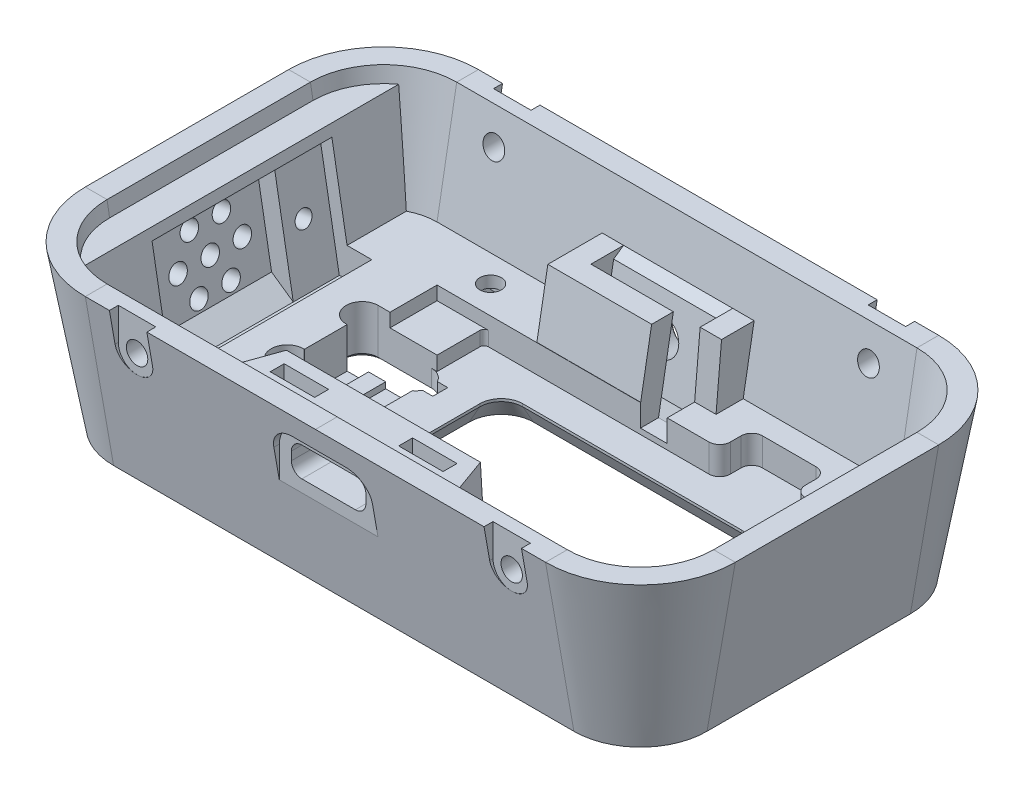
from build123d import *
from OCP.BRepFilletAPI import BRepFilletAPI_MakeChamfer

# Parameters (mm, degrees)
SKETCH57_W                      = 67.31
SKETCH57_H                      = 36.83
BOSS_EXTRUDE18_DEPTH            = 2.54
CUT_EXTRUDE28_DEPTH             = 39.447663778
FILLET5_R                       = 6.35
BOSS_EXTRUDE2_START             = 3.302
SKETCH4_W                       = 51.816
SKETCH4_H                       = 23.876
BOSS_EXTRUDE2_DEPTH             = 3.302
SKETCH5_W                       = 4.953
SKETCH5_H                       = 5.588
SKETCH5_W_2                     = 5.588
SKETCH5_W_3                     = 5.334
SKETCH5_H_2                     = 6.35
BOSS_EXTRUDE3_DEPTH             = 1.6891
SKETCH7_R                       = 1.5875
CUT_EXTRUDE3_DEPTH              = 1.9812
SKETCH8_R                       = 0.635
CUT_EXTRUDE4_DEPTH              = 49.097728858
CUT_EXTRUDE5_DEPTH              = 48.996469213
CUT_EXTRUDE5_DEPTH_BACK         = 48.996469213
CUT_EXTRUDE6_DEPTH              = 48.441964902
CUT_EXTRUDE6_DEPTH_BACK         = 3.175
SKETCH10_W                      = 2.54
SKETCH10_H                      = 7.29723455
SKETCH11_W                      = 5.973982403
SKETCH11_H                      = 1.778
CUT_EXTRUDE7_DEPTH              = 1.4859
SKETCH59_W                      = 3.683
SKETCH59_H                      = 5.08
CUT_EXTRUDE29_DEPTH             = 0.2921
CHAMFER3_SIZE                   = 0.508
CHAMFER6_SIZE                   = 2.2225
CHAMFER6_SIZE2                  = 1.283160973
SKETCH76_R                      = 1.27
CUT_EXTRUDE39_DEPTH             = 4.826
CUT_EXTRUDE35_DEPTH             = 1.7018
SKETCH73_W                      = 2.54
SKETCH73_H                      = 5.2705
CUT_EXTRUDE37_DEPTH             = 0.5
SKETCH75_W                      = 2.54
SKETCH75_H                      = 2.54
CUT_EXTRUDE38_DEPTH             = 0.5
MIRROR4_COPY_1_DEPTH            = 1.7018
MIRROR4_COPY_2_SKETCH_W         = 2.54
MIRROR4_COPY_2_SKETCH_H         = 5.2705
MIRROR4_COPY_2_DEPTH            = 0.5
MIRROR4_COPY_3_SKETCH_W         = 2.54
MIRROR4_COPY_3_SKETCH_H         = 2.54
MIRROR4_COPY_3_DEPTH            = 0.5
SKETCH79_W                      = 2.794
SKETCH79_H                      = 5.842
CUT_EXTRUDE41_DEPTH             = 1.016
CUT_EXTRUDE18_REACH             = 57.618
SKETCH28_W                      = 12.954
SKETCH28_H                      = 10.476570005
SKETCH18_R                      = 2.00025
CUT_EXTRUDE14_DEPTH             = 60.890421674
SKETCH19_W                      = 18.034
SKETCH19_H                      = 15.748
SKETCH19_W_2                    = 12.954
SKETCH19_H_2                    = 10.668
BOSS_EXTRUDE4_DEPTH             = 3.81
SKETCH23_W                      = 12.954
SKETCH23_H                      = 3.81
CUT_EXTRUDE15_DEPTH             = 50.268858544
CUT_EXTRUDE34_REACH             = 56.18
CUT_EXTRUDE34_DIRECTION_2_REACH = 56.18
BOSS_EXTRUDE6_DEPTH             = 18.034
CUT_EXTRUDE17_REACH             = 57.618
SKETCH27_W                      = 3.175
SKETCH27_H                      = 20.919786291
CUT_EXTRUDE30_REACH             = 58.309
CUT_EXTRUDE40_DEPTH             = 5.715
CHAMFER8_SIZE                   = 0.254
BOSS_EXTRUDE19_START            = 1.016
SKETCH78_W                      = 12.954
SKETCH78_H                      = 10.832571096
SKETCH78_R                      = 2.00025
BOSS_EXTRUDE19_DEPTH            = 1.016
CHAMFER9_SIZE                   = 1.016
CUT_EXTRUDE20_DEPTH             = 3.140582
SKETCH36_R                      = 1.27
CUT_EXTRUDE21_DEPTH             = 5.715
BOSS_EXTRUDE9_DEPTH             = 11.43
CUT_EXTRUDE22_DEPTH             = 58.778283606
CUT_EXTRUDE23_DEPTH             = 20.32
SKETCH42_R                      = 1.27
CUT_EXTRUDE24_DEPTH             = 5.08
SKETCH64_W                      = 8.8392
SKETCH64_H                      = 6.9977
CUT_EXTRUDE31_DEPTH             = 1.27
CUT_EXTRUDE33_DEPTH             = 1.651
CUT_EXTRUDE32_REACH             = 60.362
CHAMFER7_SIZE                   = 5.334
CHAMFER7_SIZE_2                 = 1.94141723
CUT_EXTRUDE25_DEPTH             = 10.668
SKETCH48_W                      = 24.384
SKETCH48_H                      = 16.51
SKETCH48_W_2                    = 21.336
SKETCH48_H_2                    = 13.716
BOSS_EXTRUDE12_DEPTH            = 3.7465
SKETCH45_R                      = 0.9906
BOSS_EXTRUDE10_DEPTH            = 2.2225
BOSS_EXTRUDE14_DEPTH            = 2.2225
CHAMFER5_SIZE                   = 2.2225
BOSS_EXTRUDE15_REACH            = 57.779
CUT_EXTRUDE27_START             = -3.81
SKETCH54_R                      = 0.9906
CUT_EXTRUDE27_DEPTH             = 3.81
FILL_START                      = -34.669252274
FILL_PATTERN2_OUTLINE_R         = 1.0795
FILL_PATTERN2_DEPTH             = 2.159
BOSS_EXTRUDE16_REACH            = 57.779
BOSS_EXTRUDE17_REACH            = 57.779
SKETCH80_W                      = 8.89
SKETCH80_H                      = 3.81
CUT_EXTRUDE42_DEPTH             = 3.302
FILLET8_R                       = 1.27
FILLET6_R                       = 0.508


with BuildPart() as part:
    # Sketch57 → Boss-Extrude18 (new body)
    with BuildSketch(Plane(origin=(0, 0, 0), x_dir=(1, 0, 0), z_dir=(0, 1, 0))):
        Rectangle(SKETCH57_W, SKETCH57_H)
    extrude(amount=BOSS_EXTRUDE18_DEPTH)

    # Sketch58 → Cut-Extrude28 (cut, through all)
    with BuildSketch(Plane(origin=(0, 2.54, 0), x_dir=(1, 0, 0), z_dir=(0, 1, 0))):
        with BuildLine():
            Line((-9.398, 5.588), (-9.398, -5.6134))
            ThreePointArc((-9.398, -5.6134), (-8.654051224, -7.409451224), (-6.858, -8.1534))
            Line((-6.858, -8.1534), (19.0754, -8.1534))
            ThreePointArc((19.0754, -8.1534), (20.871451224, -7.409451224), (21.6154, -5.6134))
            Line((21.6154, -5.6134), (21.6154, 5.588))
            ThreePointArc((21.6154, 5.588), (20.871451224, 7.384051224), (19.0754, 8.128))
            Line((19.0754, 8.128), (-6.858, 8.128))
            ThreePointArc((-6.858, 8.128), (-8.654051224, 7.384051224), (-9.398, 5.588))
        make_face()
    extrude(amount=-CUT_EXTRUDE28_DEPTH, mode=Mode.SUBTRACT)

    # Fillet5
    fillet5_edges = [part.edges().sort_by_distance(p)[0] for p in [
        (33.655, 1.27, 18.415),
        (-33.655, 1.27, 18.415),
        (-33.655, 1.27, -18.415),
        (33.655, 1.27, -18.415),
    ]]
    fillet(fillet5_edges, radius=FILLET5_R)

    # Sketch4 → Boss-Extrude2 (add)
    with BuildSketch(Plane(origin=(0, 2.54, 0), x_dir=(1, 0, 0), z_dir=(0, 1, 0)).offset(BOSS_EXTRUDE2_START)):
        with BuildLine():
            Line((27.305, 18.415), (-27.305, 18.415))
            ThreePointArc((-27.305, 18.415), (-31.795128061, 16.555128061), (-33.655, 12.065))
            Line((-33.655, 12.065), (-33.655, -12.065))
            ThreePointArc((-33.655, -12.065), (-31.795128061, -16.555128061), (-27.305, -18.415))
            Line((-27.305, -18.415), (27.305, -18.415))
            ThreePointArc((27.305, -18.415), (31.795128061, -16.555128061), (33.655, -12.065))
            Line((33.655, -12.065), (33.655, 12.065))
            ThreePointArc((33.655, 12.065), (31.795128061, 16.555128061), (27.305, 18.415))
        make_face()
        with Locations((5.08, 0)):
            Rectangle(SKETCH4_W, SKETCH4_H, mode=Mode.SUBTRACT)
    extrude(amount=-BOSS_EXTRUDE2_DEPTH)

    # Sweep1: sweep along a path in Sketch15
    with BuildLine(Plane.XZ) as sweep1_path:
        Line((-33.655, 12.065), (-33.655, -12.065))
        ThreePointArc((-33.655, -12.065), (-31.795128061, -16.555128061), (-27.305, -18.415))
        Line((-27.305, -18.415), (27.305, -18.415))
        ThreePointArc((27.305, -18.415), (31.795128061, -16.555128061), (33.655, -12.065))
        Line((33.655, -12.065), (33.655, 12.065))
        ThreePointArc((33.655, 12.065), (31.795128061, 16.555128061), (27.305, 18.415))
        Line((27.305, 18.415), (-27.305, 18.415))
        ThreePointArc((-27.305, 18.415), (-31.795128061, 16.555128061), (-33.655, 12.065))
    # Sketch14 → Sweep1 (sweep)
    with BuildSketch(Plane(origin=(0, 0, 0), x_dir=(0, 0, -1), z_dir=(1, 0, 0))):
        Polygon((-19.964081373, 0), (-23.323110355, 19.05), (-20.743926761, 19.05), (-17.384897779, 0), align=None)
    sweep(path=sweep1_path.line)

    # Sketch5 → Boss-Extrude3 (add)
    with BuildSketch(Plane(origin=(0, 2.54, 0), x_dir=(1, 0, 0), z_dir=(0, 1, 0))):
        with Locations((-18.3515, -9.144)):
            Rectangle(SKETCH5_W, SKETCH5_H)
        with Locations((-18.034, 9.144)):
            Rectangle(SKETCH5_W_2, SKETCH5_H)
        with Locations((28.321, -8.763)):
            Rectangle(SKETCH5_W_3, SKETCH5_H_2)
        with Locations((28.321, 8.763)):
            Rectangle(SKETCH5_W_3, SKETCH5_H_2)
    extrude(amount=BOSS_EXTRUDE3_DEPTH)

    # Sketch7 → Cut-Extrude3 (cut)
    with BuildSketch(Plane(origin=(0, 4.2291, 0), x_dir=(1, 0, 0), z_dir=(0, 1, 0))):
        with Locations(Location((-12.954, -9.398, 0), (0, 0, 270))):
            Circle(SKETCH7_R)
    extrude(amount=-CUT_EXTRUDE3_DEPTH, mode=Mode.SUBTRACT)

    # Sketch8 → Cut-Extrude4 (cut, through all)
    with BuildSketch(Plane(origin=(0, 2.2479, 0), x_dir=(1, 0, 0), z_dir=(0, 1, 0))):
        with Locations(Location((-12.954, -9.398, 0), (0, 0, 270))):
            Circle(SKETCH8_R)
    extrude(amount=-CUT_EXTRUDE4_DEPTH, mode=Mode.SUBTRACT)

    # Sketch9 → Cut-Extrude5 (cut, two sides: drawn at the far end of the back side and taken through both)
    with BuildSketch(Plane.XZ.offset(-2.54).offset(-CUT_EXTRUDE5_DEPTH_BACK)):
        with BuildLine():
            Line((-15.875, -6.35), (-22.225, -6.35))
            ThreePointArc((-22.225, -6.35), (-24.13, -4.445), (-22.225, -2.54))
            Line((-22.225, -2.54), (-15.875, -2.54))
            ThreePointArc((-15.875, -2.54), (-13.97, -4.445), (-15.875, -6.35))
        make_face()
        with BuildLine():
            Line((-15.875, 6.35), (-22.225, 6.35))
            ThreePointArc((-22.225, 6.35), (-24.13, 4.445), (-22.225, 2.54))
            Line((-22.225, 2.54), (-15.875, 2.54))
            ThreePointArc((-15.875, 2.54), (-13.97, 4.445), (-15.875, 6.35))
        make_face()
    extrude(amount=CUT_EXTRUDE5_DEPTH + CUT_EXTRUDE5_DEPTH_BACK, mode=Mode.SUBTRACT)

    # Sketch10 → Cut-Extrude6 (cut, two sides: drawn at the far end of the back side and taken through both)
    with BuildSketch(Plane(origin=(0, 4.2291, 0), x_dir=(1, 0, 0), z_dir=(0, 1, 0)).offset(-CUT_EXTRUDE6_DEPTH_BACK)):
        with Locations((-20.828, -0.008670508)):
            Rectangle(SKETCH10_W, SKETCH10_H)
    extrude(amount=CUT_EXTRUDE6_DEPTH + CUT_EXTRUDE6_DEPTH_BACK, mode=Mode.SUBTRACT)

    # Sketch11 → Cut-Extrude7 (cut)
    with BuildSketch(Plane(origin=(0, 2.54, 0), x_dir=(1, 0, 0), z_dir=(0, 1, 0))):
        with Locations((-15.940991202, 4.445)):
            Rectangle(SKETCH11_W, SKETCH11_H)
        with Locations((-15.940991202, -4.445)):
            Rectangle(SKETCH11_W, SKETCH11_H)
    extrude(amount=-CUT_EXTRUDE7_DEPTH, mode=Mode.SUBTRACT)

    # Sketch59 → Cut-Extrude29 (cut)
    with BuildSketch(Plane(origin=(0, 2.54, 0), x_dir=(1, 0, 0), z_dir=(0, 1, 0))):
        with Locations((-17.7165, 0)):
            Rectangle(SKETCH59_W, SKETCH59_H)
    extrude(amount=-CUT_EXTRUDE29_DEPTH, mode=Mode.SUBTRACT)

    # Chamfer3
    chamfer3_edges = [part.edges().sort_by_distance(p)[0] for p in [
        (-13.97, 0, -4.445),
        (-19.05, 0, -2.54),
        (-24.13, 0, -4.445),
        (-19.05, 0, -6.35),
        (-13.97, 0, 4.445),
        (-19.05, 0, 6.35),
        (-24.13, 0, 4.445),
        (-19.05, 0, 2.54),
    ]]
    chamfer(chamfer3_edges, length=CHAMFER3_SIZE)

    # Chamfer6: one chamfer whose edges measure the first distance from different faces: ONE call of the kernel's chamfer builder (chamfer() names one face for all edges)
    chamfer6_edges_1 = [part.edges().sort_by_distance(p)[0] for p in [
        (-8.654051224, 0, 7.409451224),
    ]]
    chamfer6_side_1 = [part.faces().sort_by_distance(p)[0] for p in [
        (-8.654051224, 1.27, 7.409451224),
    ]]
    chamfer6_edges_2 = [part.edges().sort_by_distance(p)[0] for p in [
        (-9.398, 0, 0.0127),
    ]]
    chamfer6_side_2 = [part.faces().sort_by_distance(p)[0] for p in [
        (-9.398, 1.27, 0.0127),
    ]]
    chamfer6_edges_3 = [part.edges().sort_by_distance(p)[0] for p in [
        (-8.654051224, 0, -7.384051224),
    ]]
    chamfer6_side_3 = [part.faces().sort_by_distance(p)[0] for p in [
        (-8.654051224, 1.27, -7.384051224),
    ]]
    chamfer6_edges_4 = [part.edges().sort_by_distance(p)[0] for p in [
        (6.1087, 0, -8.128),
    ]]
    chamfer6_side_4 = [part.faces().sort_by_distance(p)[0] for p in [
        (6.1087, 1.27, -8.128),
    ]]
    chamfer6_edges_5 = [part.edges().sort_by_distance(p)[0] for p in [
        (20.871451224, 0, -7.384051224),
    ]]
    chamfer6_side_5 = [part.faces().sort_by_distance(p)[0] for p in [
        (20.871451224, 1.27, -7.384051224),
    ]]
    chamfer6_edges_6 = [part.edges().sort_by_distance(p)[0] for p in [
        (21.6154, 0, 0.0127),
    ]]
    chamfer6_side_6 = [part.faces().sort_by_distance(p)[0] for p in [
        (21.6154, 1.27, 0.0127),
    ]]
    chamfer6_edges_7 = [part.edges().sort_by_distance(p)[0] for p in [
        (20.871451224, 0, 7.409451224),
    ]]
    chamfer6_side_7 = [part.faces().sort_by_distance(p)[0] for p in [
        (20.871451224, 1.27, 7.409451224),
    ]]
    chamfer6_edges_8 = [part.edges().sort_by_distance(p)[0] for p in [
        (6.1087, 0, 8.1534),
    ]]
    chamfer6_side_8 = [part.faces().sort_by_distance(p)[0] for p in [
        (6.1087, 1.27, 8.1534),
    ]]
    chamfer6 = BRepFilletAPI_MakeChamfer(part.part.solid().wrapped)
    for e in chamfer6_edges_1:
        chamfer6.Add(CHAMFER6_SIZE, CHAMFER6_SIZE2, e.wrapped, chamfer6_side_1[0].wrapped)  # the first distance lies on this face
    for e in chamfer6_edges_2:
        chamfer6.Add(CHAMFER6_SIZE, CHAMFER6_SIZE2, e.wrapped, chamfer6_side_2[0].wrapped)  # the first distance lies on this face
    for e in chamfer6_edges_3:
        chamfer6.Add(CHAMFER6_SIZE, CHAMFER6_SIZE2, e.wrapped, chamfer6_side_3[0].wrapped)  # the first distance lies on this face
    for e in chamfer6_edges_4:
        chamfer6.Add(CHAMFER6_SIZE, CHAMFER6_SIZE2, e.wrapped, chamfer6_side_4[0].wrapped)  # the first distance lies on this face
    for e in chamfer6_edges_5:
        chamfer6.Add(CHAMFER6_SIZE, CHAMFER6_SIZE2, e.wrapped, chamfer6_side_5[0].wrapped)  # the first distance lies on this face
    for e in chamfer6_edges_6:
        chamfer6.Add(CHAMFER6_SIZE, CHAMFER6_SIZE2, e.wrapped, chamfer6_side_6[0].wrapped)  # the first distance lies on this face
    for e in chamfer6_edges_7:
        chamfer6.Add(CHAMFER6_SIZE, CHAMFER6_SIZE2, e.wrapped, chamfer6_side_7[0].wrapped)  # the first distance lies on this face
    for e in chamfer6_edges_8:
        chamfer6.Add(CHAMFER6_SIZE, CHAMFER6_SIZE2, e.wrapped, chamfer6_side_8[0].wrapped)  # the first distance lies on this face
    add(Compound.cast(chamfer6.Shape()), mode=Mode.REPLACE)

    # Sketch76 → Cut-Extrude39 (cut)
    with BuildSketch(Plane(origin=(0, 5.842, 0), x_dir=(1, 0, 0), z_dir=(0, 1, 0))):
        with Locations(Location((27.94, -15.24, 0), (0, 0, 270))):
            Circle(SKETCH76_R)
        with Locations(Location((-17.78, -15.24, 0), (0, 0, 270))):
            Circle(SKETCH76_R)
        with Locations(Location((27.94, 15.24, 0), (0, 0, 270))):
            Circle(SKETCH76_R)
        with Locations(Location((-17.78, 15.24, 0), (0, 0, 270))):
            Circle(SKETCH76_R)
    extrude(amount=-CUT_EXTRUDE39_DEPTH, mode=Mode.SUBTRACT)

    # Sketch72 → Cut-Extrude35 (cut)
    with BuildSketch(Plane(origin=(0, 1.778, 0), x_dir=(1, 0, 0), z_dir=(0, 1, 0))):
        Polygon((26.418537703, -17.87525), (29.461462297, -17.87525), (30.982924594, -15.24), (29.461462297, -12.60475), (26.418537703, -12.60475), (24.897075406, -15.24), align=None)
    cut_extrude35 = extrude(amount=CUT_EXTRUDE35_DEPTH, mode=Mode.SUBTRACT)

    # Sketch73 → Cut-Extrude37 (cut)
    with BuildSketch(Plane.XZ.offset(-3.4798)):
        with Locations((27.94, 15.24)):
            Rectangle(SKETCH73_W, SKETCH73_H)
    cut_extrude37 = extrude(amount=-CUT_EXTRUDE37_DEPTH, mode=Mode.SUBTRACT)

    # Sketch75 → Cut-Extrude38 (cut)
    with BuildSketch(Plane.XZ.offset(-3.9798)):
        with Locations((27.94, 15.24)):
            Rectangle(SKETCH75_W, SKETCH75_H)
    cut_extrude38 = extrude(amount=-CUT_EXTRUDE38_DEPTH, mode=Mode.SUBTRACT)

    # Mirror3: Cut-Extrude35, Cut-Extrude37, Cut-Extrude38 across plane
    add(cut_extrude35.mirror(Plane(origin=(5.08, 0, 0), x_dir=(0, 0, 1), z_dir=(1, 0, 0))), mode=Mode.SUBTRACT)
    add(cut_extrude37.mirror(Plane(origin=(5.08, 0, 0), x_dir=(0, 0, 1), z_dir=(1, 0, 0))), mode=Mode.SUBTRACT)
    add(cut_extrude38.mirror(Plane(origin=(5.08, 0, 0), x_dir=(0, 0, 1), z_dir=(1, 0, 0))), mode=Mode.SUBTRACT)

    # Mirror4: Cut-Extrude35, Cut-Extrude37, Cut-Extrude38 across plane
    add(cut_extrude35.mirror(Plane.XY), mode=Mode.SUBTRACT)
    add(cut_extrude37.mirror(Plane.XY), mode=Mode.SUBTRACT)
    add(cut_extrude38.mirror(Plane.XY), mode=Mode.SUBTRACT)

    # Mirror4 copy 1 sketch → Mirror4 copy 1 (cut)
    with BuildSketch(Plane(origin=(10.16, 1.778, 0), x_dir=(-1, 0, 0), z_dir=(0, 1, 0))):
        Polygon((26.418537703, -17.87525), (29.461462297, -17.87525), (30.982924594, -15.24), (29.461462297, -12.60475), (26.418537703, -12.60475), (24.897075406, -15.24), align=None)
    extrude(amount=MIRROR4_COPY_1_DEPTH, mode=Mode.SUBTRACT)

    # Mirror4 copy 2 sketch → Mirror4 copy 2 (cut)
    with BuildSketch(Plane(origin=(10.16, 3.4798, 0), x_dir=(-1, 0, 0), z_dir=(0, -1, 0))):
        with Locations((27.94, 15.24)):
            Rectangle(MIRROR4_COPY_2_SKETCH_W, MIRROR4_COPY_2_SKETCH_H)
    extrude(amount=-MIRROR4_COPY_2_DEPTH, mode=Mode.SUBTRACT)

    # Mirror4 copy 3 sketch → Mirror4 copy 3 (cut)
    with BuildSketch(Plane(origin=(10.16, 3.9798, 0), x_dir=(-1, 0, 0), z_dir=(0, -1, 0))):
        with Locations((27.94, 15.24)):
            Rectangle(MIRROR4_COPY_3_SKETCH_W, MIRROR4_COPY_3_SKETCH_H)
    extrude(amount=-MIRROR4_COPY_3_DEPTH, mode=Mode.SUBTRACT)

    # Sketch79 → Cut-Extrude41 (cut)
    with BuildSketch(Plane(origin=(0, 2.54, 0), x_dir=(1, 0, 0), z_dir=(0, 1, 0))):
        with Locations((-16.129, 0)):
            Rectangle(SKETCH79_W, SKETCH79_H)
    extrude(amount=-CUT_EXTRUDE41_DEPTH, mode=Mode.SUBTRACT)

    # Cut-Extrude18: up to this plane
    cut_extrude18_end = Plane(origin=(-27.305, 19.05, -20.743926761), z_dir=(0, -0.17364817766692375, -0.9848077530122092))
    # Sketch28 → Cut-Extrude18 (cut, up to the surface)
    with BuildSketch(Plane.XY.offset(-11.938), mode=Mode.PRIVATE) as cut_extrude18_sk1:
        with Locations((0, 7.778285003)):
            Rectangle(SKETCH28_W, SKETCH28_H)
    cut_extrude18_tool1 = split(extrude(cut_extrude18_sk1.sketch, amount=-CUT_EXTRUDE18_REACH, mode=Mode.PRIVATE), bisect_by=cut_extrude18_end, keep=Keep.BOTH, mode=Mode.PRIVATE)
    add(cut_extrude18_tool1.solids().sort_by_distance((0, 7.778285, -11.938))[0], mode=Mode.SUBTRACT)

    # Sketch18 → Cut-Extrude14 (cut, through all)
    with BuildSketch(Plane(origin=(0, -2.972992615, -16.860678967), x_dir=(1, 0, 0), z_dir=(0, 0.17364817766692373, 0.9848077530122092))):
        with Locations(Location((0, 10.932039412, 0), (0, 0, 270))):
            Circle(SKETCH18_R)
    extrude(amount=-CUT_EXTRUDE14_DEPTH, mode=Mode.SUBTRACT)

    # Sketch19 → Boss-Extrude4 (add)
    with BuildSketch(Plane(origin=(0, -2.972992615, -16.860678967), x_dir=(1, 0, 0), z_dir=(0, 0.17364817766692373, 0.9848077530122092))):
        with Locations((0, 10.932039412)):
            Rectangle(SKETCH19_W, SKETCH19_H)
        with Locations((0, 10.932039412)):
            Rectangle(SKETCH19_W_2, SKETCH19_H_2, mode=Mode.SUBTRACT)
    extrude(amount=BOSS_EXTRUDE4_DEPTH)

    # Sketch23 → Cut-Extrude15 (cut, through all)
    with BuildSketch(Plane(origin=(0, 16.018921724, -2.824568102), x_dir=(1, 0, 0), z_dir=(0, -0.9848077530122092, 0.1736481776669237))):
        with Locations((0, -15.215782118)):
            Rectangle(SKETCH23_W, SKETCH23_H)
    extrude(amount=-CUT_EXTRUDE15_DEPTH, mode=Mode.SUBTRACT)

    # Cut-Extrude34: up to this face of the body (flat: up to its plane)
    cut_extrude34_end = Plane(part.part.faces().sort_by_distance((-9.017, 10.861887531, -17.344500892))[0])
    # Sketch71 → Cut-Extrude34 (cut, up to the picked face)
    with BuildSketch(Plane(origin=(-6.477, 0, 0), x_dir=(0, 0, -1), z_dir=(1, 0, 0)), mode=Mode.PRIVATE) as cut_extrude34_sk1:
        Polygon((15.845049149, 13.208), (19.71382454, 13.208), (20.12631344, 15.547340802), (16.374195901, 16.208940359), align=None)
    cut_extrude34_tool1 = split(extrude(cut_extrude34_sk1.sketch, amount=-CUT_EXTRUDE34_REACH, mode=Mode.PRIVATE), bisect_by=cut_extrude34_end, keep=Keep.BOTH, mode=Mode.PRIVATE)
    add(cut_extrude34_tool1.solids().sort_by(Axis((-6.477, 14.549901, -17.936167), (-1, 0, 0)))[0], mode=Mode.SUBTRACT)

    # Cut-Extrude34 direction 2: up to this face of the body (flat: up to its plane)
    cut_extrude34_direction_2_end = Plane(part.part.faces().sort_by_distance((9.017, 10.861887531, -17.344500892))[0])
    # Sketch71 → Cut-Extrude34 direction 2 (cut, up to the picked face)
    with BuildSketch(Plane(origin=(-6.477, 0, 0), x_dir=(0, 0, -1), z_dir=(1, 0, 0)), mode=Mode.PRIVATE) as cut_extrude34_direction_2_sk1:
        Polygon((15.845049149, 13.208), (19.71382454, 13.208), (20.12631344, 15.547340802), (16.374195901, 16.208940359), align=None)
    cut_extrude34_direction_2_tool1 = split(extrude(cut_extrude34_direction_2_sk1.sketch, amount=CUT_EXTRUDE34_DIRECTION_2_REACH, mode=Mode.PRIVATE), bisect_by=cut_extrude34_direction_2_end, keep=Keep.BOTH, mode=Mode.PRIVATE)
    add(cut_extrude34_direction_2_tool1.solids().sort_by(Axis((-6.477, 14.549901, -17.936167), (1, 0, 0)))[0], mode=Mode.SUBTRACT)

    # Sketch24 → Boss-Extrude6 (add)
    with BuildSketch(Plane.ZY.offset(9.017)):
        Polygon((-15.845049149, 13.208), (-11.938, 13.208), (-11.938, 2.54), (-13.963992918, 2.54), align=None)
    extrude(amount=-BOSS_EXTRUDE6_DEPTH)

    # Sketch27 → Cut-Extrude17 (cut, up to next)
    with BuildSketch(Plane.XY.offset(-11.938), mode=Mode.PRIVATE) as cut_extrude17_sk1:
        with Locations((4.8895, 13.661492703)):
            Rectangle(SKETCH27_W, SKETCH27_H)
    cut_extrude17_tool1 = extrude(cut_extrude17_sk1.sketch, amount=-CUT_EXTRUDE17_REACH, mode=Mode.PRIVATE) & part.part
    add(cut_extrude17_tool1.solids().sort_by_distance((4.8895, 13.661493, -11.938))[0], mode=Mode.SUBTRACT)

    # Cut-Extrude30: up to this face of the body (flat: up to its plane)
    cut_extrude30_end = Plane(part.part.faces().sort_by_distance((9.017, 9.636874218, -15.511069356))[0])
    # Sketch62 → Cut-Extrude30 (cut, up to the picked face)
    with BuildSketch(Plane.ZY.offset(9.017), mode=Mode.PRIVATE) as cut_extrude30_sk1:
        Polygon((-13.265865554, 13.208), (-11.967041015, 5.842), (-11.938, 5.842), (-11.938, 13.208), align=None)
    cut_extrude30_tool1 = split(extrude(cut_extrude30_sk1.sketch, amount=-CUT_EXTRUDE30_REACH, mode=Mode.PRIVATE), bisect_by=cut_extrude30_end, keep=Keep.BOTH, mode=Mode.PRIVATE)
    add(cut_extrude30_tool1.solids().sort_by(Axis((-9.017, 10.700117, -12.380829), (1, 0, 0)))[0], mode=Mode.SUBTRACT)

    # Sketch77 → Cut-Extrude40 (cut)
    with BuildSketch(Plane(origin=(9.017, 0, 0), x_dir=(0, 0, -1), z_dir=(1, 0, 0))):
        Polygon((15.845049149, 13.208), (13.265865554, 13.208), (11.967041015, 5.842), (15.191020507, 5.842), align=None)
    extrude(amount=-CUT_EXTRUDE40_DEPTH, mode=Mode.SUBTRACT)

    # Chamfer8
    chamfer8_edges = [part.edges().sort_by_distance(p)[0] for p in [
        (0, 9.321759891, -21.607759149),
    ]]
    chamfer(chamfer8_edges, length=CHAMFER8_SIZE)

    # Sketch78 → Boss-Extrude19 (add)
    with BuildSketch(Plane(origin=(0, -2.972992615, -16.860678967), x_dir=(1, 0, 0), z_dir=(0, 0.17364817766692378, 0.9848077530122094)).offset(BOSS_EXTRUDE19_START)):
        with Locations((0, 11.01432496)):
            Rectangle(SKETCH78_W, SKETCH78_H)
        with Locations(Location((0, 10.932039412, 0), (0, 0, 270))):
            Circle(SKETCH78_R, mode=Mode.SUBTRACT)
    extrude(amount=-BOSS_EXTRUDE19_DEPTH)

    # Chamfer9
    # the kernel refuses this chamfer: 1.016 mm, written as the material it takes off along each edge
    with BuildSketch(Plane(origin=(-6.477, 13.384426549, -18.713259863), x_dir=(0, -0.9848077530122095, 0.17364817766692217), z_dir=(1, 0, 0))) as chamfer9_piece_1_section:
        Polygon((CHAMFER9_SIZE, 0), (0, CHAMFER9_SIZE), (0, 0), align=None)
    chamfer9_piece_1 = extrude(amount=12.954, mode=Mode.PRIVATE)
    chamfer9_piece_1 = split(chamfer9_piece_1, bisect_by=Plane(origin=(-6.477, 13.208, -19.71382454), z_dir=(0, 0.17364817766692364, 0.9848077530122092)), keep=Keep.TOP, mode=Mode.PRIVATE)
    add(chamfer9_piece_1, mode=Mode.SUBTRACT)

    # Sketch33 → Cut-Extrude20 (cut)
    with BuildSketch(Plane.XY.offset(-25.4)):
        with BuildLine():
            Line((-24.4475, 15.24), (-24.4475, 19.05))
            Line((-24.4475, 19.05), (-20.0025, 19.05))
            Line((-20.0025, 19.05), (-20.0025, 15.24))
            ThreePointArc((-20.0025, 15.24), (-22.225, 13.0175), (-24.4475, 15.24))
        make_face()
        with BuildLine():
            Line((20.0025, 19.05), (20.0025, 15.24))
            ThreePointArc((20.0025, 15.24), (22.225, 13.0175), (24.4475, 15.24))
            Line((24.4475, 15.24), (24.4475, 19.05))
            Line((24.4475, 19.05), (20.0025, 19.05))
        make_face()
    cut_extrude20 = extrude(amount=CUT_EXTRUDE20_DEPTH, mode=Mode.SUBTRACT)

    # Sketch36 → Cut-Extrude21 (cut)
    with BuildSketch(Plane(origin=(0, 0, -22.259417844), x_dir=(-1, 0, 0), z_dir=(0, 0, -1))):
        with Locations((22.225, 15.24)):
            Circle(SKETCH36_R)
        with Locations((-22.225, 15.24)):
            Circle(SKETCH36_R)
    cut_extrude21 = extrude(amount=-CUT_EXTRUDE21_DEPTH, mode=Mode.SUBTRACT)

    # Mirror1: Cut-Extrude20, Cut-Extrude21 across plane
    add(cut_extrude20.mirror(Plane.XY), mode=Mode.SUBTRACT)
    add(cut_extrude21.mirror(Plane.XY), mode=Mode.SUBTRACT)

    # Sketch38 → Boss-Extrude9 (add, symmetric)
    with BuildSketch(Plane(origin=(0, 0, 0), x_dir=(0, 0, -1), z_dir=(1, 0, 0))):
        Polygon((-23.03199451, 17.399), (-15.255563497, 17.399), (-15.255563497, 5.842), (-20.994183594, 5.842), align=None)
    extrude(amount=BOSS_EXTRUDE9_DEPTH, both=True)

    # Sketch39 → Cut-Extrude22 (cut, through all)
    with BuildSketch(Plane(origin=(0, 0, 15.255563497), x_dir=(-1, 0, 0), z_dir=(0, 0, -1))):
        with BuildLine():
            Line((4.4196, 13.8303), (4.4196, 12.8397))
            ThreePointArc((4.4196, 12.8397), (4.0550651, 11.9596349), (3.175, 11.5951))
            Line((3.175, 11.5951), (-3.175, 11.5951))
            ThreePointArc((-3.175, 11.5951), (-4.0550651, 11.9596349), (-4.4196, 12.8397))
            Line((-4.4196, 12.8397), (-4.4196, 13.8303))
            ThreePointArc((-4.4196, 13.8303), (-4.0550651, 14.7103651), (-3.175, 15.0749))
            Line((-3.175, 15.0749), (3.175, 15.0749))
            ThreePointArc((3.175, 15.0749), (4.0550651, 14.7103651), (4.4196, 13.8303))
        make_face()
    extrude(amount=-CUT_EXTRUDE22_DEPTH, mode=Mode.SUBTRACT)

    # Sketch41 → Cut-Extrude23 (cut)
    with BuildSketch(Plane(origin=(0, 13.335, 21.755563497), x_dir=(-1, 0, 0), z_dir=(0, 0, -1))):
        with BuildLine():
            Line((3.175, 3.175), (-3.175, 3.175))
            ThreePointArc((-3.175, 3.175), (-5.069834042, 2.390134042), (-5.8547, 0.4953))
            Line((-5.8547, 0.4953), (-5.8547, -0.4953))
            Line((-5.8547, -0.4953), (-5.8547, -5.2431151))
            Line((-5.8547, -5.2431151), (5.8547, -5.2431151))
            Line((5.8547, -5.2431151), (5.8547, -0.4953))
            Line((5.8547, -0.4953), (5.8547, 0.4953))
            ThreePointArc((5.8547, 0.4953), (5.069834042, 2.390134042), (3.175, 3.175))
        make_face()
    extrude(amount=-CUT_EXTRUDE23_DEPTH, mode=Mode.SUBTRACT)

    # Sketch42 → Cut-Extrude24 (cut)
    with BuildSketch(Plane(origin=(0, 0, 15.255563497), x_dir=(-1, 0, 0), z_dir=(0, 0, -1))):
        with Locations((-7.62, 13.335)):
            Circle(SKETCH42_R)
        with Locations(Location((7.62, 13.335, 0), (0, 0, 180))):
            Circle(SKETCH42_R)
    extrude(amount=-CUT_EXTRUDE24_DEPTH, mode=Mode.SUBTRACT)

    # Sketch64 → Cut-Extrude31 (cut)
    with BuildSketch(Plane(origin=(0, 0, 15.255563497), x_dir=(-1, 0, 0), z_dir=(0, 0, -1))):
        with Locations((0, 9.34085)):
            Rectangle(SKETCH64_W, SKETCH64_H)
    extrude(amount=-CUT_EXTRUDE31_DEPTH, mode=Mode.SUBTRACT)

    # Sketch69 → Cut-Extrude33 (cut)
    with BuildSketch(Plane(origin=(0, 0, 16.779563497), x_dir=(-1, 0, 0), z_dir=(0, 0, -1))):
        Polygon((-10.25525, 14.856462297), (-10.25525, 11.813537703), (-7.62, 10.292075406), (-4.98475, 11.813537703), (-4.98475, 14.856462297), (-4.98475, 19.31080038), (-10.25525, 19.38750381), align=None)
    cut_extrude33 = extrude(amount=-CUT_EXTRUDE33_DEPTH, mode=Mode.SUBTRACT)

    # Mirror2: Cut-Extrude33 across plane
    add(cut_extrude33.mirror(Plane(origin=(0, 0, 0), x_dir=(0, 0, 1), z_dir=(1, 0, 0))), mode=Mode.SUBTRACT)

    # Cut-Extrude32: up to this face of the body (flat: up to its plane)
    cut_extrude32_end = Plane(part.part.faces().sort_by_distance((-11.43, 12.090203473, 17.386145175))[0])
    # Sketch66 → Cut-Extrude32 (cut, up to the picked face)
    with BuildSketch(Plane(origin=(11.43, 0, 0), x_dir=(0, 0, -1), z_dir=(1, 0, 0)), mode=Mode.PRIVATE) as cut_extrude32_sk1:
        Polygon((-16.525563497, 5.842), (-16.525563497, 8.382), (-15.255563497, 9.652), (-15.255563497, 5.842), align=None)
    cut_extrude32_tool1 = split(extrude(cut_extrude32_sk1.sketch, amount=-CUT_EXTRUDE32_REACH, mode=Mode.PRIVATE), bisect_by=cut_extrude32_end, keep=Keep.BOTH, mode=Mode.PRIVATE)
    add(cut_extrude32_tool1.solids().sort_by(Axis((11.43, 7.450667, 15.84823), (-1, 0, 0)))[0], mode=Mode.SUBTRACT)

    # Chamfer7
    # the kernel refuses this chamfer: 5.334, 1.94141723 mm, written as the material it adds along each edge
    with BuildSketch(Plane(origin=(11.43, 31.026212978, 22.855656236), x_dir=(0, 0.17364817766692367, -0.9848077530122094), z_dir=(0, -0.9848077530122092, -0.17364817766692364))) as chamfer7_piece_1_section:
        Polygon((CHAMFER7_SIZE, 0), (0, CHAMFER7_SIZE_2), (0, 0), align=None)
    chamfer7_piece_1 = extrude(amount=39.41015476, mode=Mode.PRIVATE)
    chamfer7_piece_1 = split(chamfer7_piece_1, bisect_by=Plane(origin=(11.43, 16.539060119, 8.368503378), z_dir=(0, 0.7071067811865436, 0.7071067811865515)), keep=Keep.TOP, mode=Mode.PRIVATE)
    chamfer7_piece_1 = split(chamfer7_piece_1, bisect_by=Plane(origin=(11.43, 31.026212978, 16.525563497), z_dir=(0, 0, 1)), keep=Keep.TOP, mode=Mode.PRIVATE)
    chamfer7_piece_1 = split(chamfer7_piece_1, bisect_by=Plane(origin=(11.43, 17.399, 22.855656236), z_dir=(0, -1, 0)), keep=Keep.TOP, mode=Mode.PRIVATE)
    add(chamfer7_piece_1)
    with BuildSketch(Plane(origin=(11.43, 31.026212978, 22.855656236), x_dir=(0, 0.17364817766692367, -0.9848077530122094), z_dir=(0, -0.9848077530122092, -0.17364817766692364))) as chamfer7_piece_2_section:
        Polygon((CHAMFER7_SIZE, 0), (0, CHAMFER7_SIZE_2), (0, 0), align=None)
    chamfer7_piece_2 = extrude(amount=39.41015476, mode=Mode.PRIVATE)
    chamfer7_piece_2 = split(chamfer7_piece_2, bisect_by=Plane(origin=(11.43, 16.539060119, 8.368503378), z_dir=(0, -0.7071067811865436, -0.7071067811865515)), keep=Keep.TOP, mode=Mode.PRIVATE)
    chamfer7_piece_2 = split(chamfer7_piece_2, bisect_by=Plane(origin=(11.43, 5.842, 22.855656236), z_dir=(0, 1, 0)), keep=Keep.TOP, mode=Mode.PRIVATE)
    chamfer7_piece_2 = split(chamfer7_piece_2, bisect_by=Plane(origin=(11.43, 31.026212978, 16.525563497), z_dir=(0, 0, 1)), keep=Keep.TOP, mode=Mode.PRIVATE)
    add(chamfer7_piece_2)
    with BuildSketch(Plane(origin=(11.43, 31.026212978, 22.855656236), x_dir=(0, 0.17364817766692367, -0.9848077530122094), z_dir=(0, -0.9848077530122092, -0.17364817766692364))) as chamfer7_piece_3_section:
        Polygon((CHAMFER7_SIZE, 0), (0, CHAMFER7_SIZE_2), (0, 0), align=None)
    chamfer7_piece_3 = extrude(amount=39.41015476, mode=Mode.PRIVATE)
    chamfer7_piece_3 = split(chamfer7_piece_3, bisect_by=Plane(origin=(11.43, 16.539060119, 8.368503378), z_dir=(0, 0.7071067811865436, 0.7071067811865515)), keep=Keep.TOP, mode=Mode.PRIVATE)
    chamfer7_piece_3 = split(chamfer7_piece_3, bisect_by=Plane(origin=(11.43, 31.026212978, 16.525563497), z_dir=(0, 0, -1)), keep=Keep.TOP, mode=Mode.PRIVATE)
    chamfer7_piece_3 = split(chamfer7_piece_3, bisect_by=Plane(origin=(11.43, 31.026212978, 15.255563497), z_dir=(0, 0, 1)), keep=Keep.TOP, mode=Mode.PRIVATE)
    chamfer7_piece_3 = split(chamfer7_piece_3, bisect_by=Plane(origin=(11.43, 17.399, 22.855656236), z_dir=(0, -1, 0)), keep=Keep.TOP, mode=Mode.PRIVATE)
    add(chamfer7_piece_3)
    with BuildSketch(Plane(origin=(-11.43, 31.026212978, 22.855656236), x_dir=(0, 0.17364817766692367, -0.9848077530122094), z_dir=(0, -0.9848077530122092, -0.17364817766692364))) as chamfer7_piece_4_section:
        Polygon((CHAMFER7_SIZE, 0), (0, -CHAMFER7_SIZE_2), (0, 0), align=None)
    chamfer7_piece_4 = extrude(amount=39.41015476, mode=Mode.PRIVATE)
    chamfer7_piece_4 = split(chamfer7_piece_4, bisect_by=Plane(origin=(-11.43, 17.399, 22.855656236), z_dir=(0, -1, 0)), keep=Keep.TOP, mode=Mode.PRIVATE)
    chamfer7_piece_4 = split(chamfer7_piece_4, bisect_by=Plane(origin=(-11.43, 31.026212978, 16.525563497), z_dir=(0, 0, 1)), keep=Keep.TOP, mode=Mode.PRIVATE)
    chamfer7_piece_4 = split(chamfer7_piece_4, bisect_by=Plane(origin=(-11.43, 16.539060119, 8.368503378), z_dir=(0, 0.7071067811865436, 0.7071067811865515)), keep=Keep.TOP, mode=Mode.PRIVATE)
    add(chamfer7_piece_4)
    with BuildSketch(Plane(origin=(-11.43, 31.026212978, 22.855656236), x_dir=(0, 0.17364817766692367, -0.9848077530122094), z_dir=(0, -0.9848077530122092, -0.17364817766692364))) as chamfer7_piece_5_section:
        Polygon((CHAMFER7_SIZE, 0), (0, -CHAMFER7_SIZE_2), (0, 0), align=None)
    chamfer7_piece_5 = extrude(amount=39.41015476, mode=Mode.PRIVATE)
    chamfer7_piece_5 = split(chamfer7_piece_5, bisect_by=Plane(origin=(-11.43, 5.842, 22.855656236), z_dir=(0, 1, 0)), keep=Keep.TOP, mode=Mode.PRIVATE)
    chamfer7_piece_5 = split(chamfer7_piece_5, bisect_by=Plane(origin=(-11.43, 31.026212978, 16.525563497), z_dir=(0, 0, 1)), keep=Keep.TOP, mode=Mode.PRIVATE)
    chamfer7_piece_5 = split(chamfer7_piece_5, bisect_by=Plane(origin=(-11.43, 16.539060119, 8.368503378), z_dir=(0, -0.7071067811865436, -0.7071067811865515)), keep=Keep.TOP, mode=Mode.PRIVATE)
    add(chamfer7_piece_5)
    with BuildSketch(Plane(origin=(-11.43, 31.026212978, 22.855656236), x_dir=(0, 0.17364817766692367, -0.9848077530122094), z_dir=(0, -0.9848077530122092, -0.17364817766692364))) as chamfer7_piece_6_section:
        Polygon((CHAMFER7_SIZE, 0), (0, -CHAMFER7_SIZE_2), (0, 0), align=None)
    chamfer7_piece_6 = extrude(amount=39.41015476, mode=Mode.PRIVATE)
    chamfer7_piece_6 = split(chamfer7_piece_6, bisect_by=Plane(origin=(-11.43, 17.399, 22.855656236), z_dir=(0, -1, 0)), keep=Keep.TOP, mode=Mode.PRIVATE)
    chamfer7_piece_6 = split(chamfer7_piece_6, bisect_by=Plane(origin=(-11.43, 31.026212978, 16.525563497), z_dir=(0, 0, -1)), keep=Keep.TOP, mode=Mode.PRIVATE)
    chamfer7_piece_6 = split(chamfer7_piece_6, bisect_by=Plane(origin=(-11.43, 16.539060119, 8.368503378), z_dir=(0, 0.7071067811865436, 0.7071067811865515)), keep=Keep.TOP, mode=Mode.PRIVATE)
    chamfer7_piece_6 = split(chamfer7_piece_6, bisect_by=Plane(origin=(-11.43, 31.026212978, 15.255563497), z_dir=(0, 0, 1)), keep=Keep.TOP, mode=Mode.PRIVATE)
    add(chamfer7_piece_6)

    # Sketch44 → Cut-Extrude25 (cut, symmetric)
    with BuildSketch(Plane.XY):
        Polygon((-33.347678216, 1.905), (-35.729436621, 15.41262314), (-27.305, 16.898078614), (-27.305, 2.970487205), align=None)
    extrude(amount=CUT_EXTRUDE25_DEPTH, both=True, mode=Mode.SUBTRACT)

    # Sketch48 → Boss-Extrude12 (add)
    with BuildSketch(Plane(origin=(-32.016348492, -5.645346063, 0), x_dir=(0, 0, -1), z_dir=(0.9848077530122094, 0.17364817766692361, 0))):
        with Locations((0, 14.397822321)):
            Rectangle(SKETCH48_W, SKETCH48_H)
        with Locations((0, 14.524822321)):
            Rectangle(SKETCH48_W_2, SKETCH48_H_2, mode=Mode.SUBTRACT)
    extrude(amount=BOSS_EXTRUDE12_DEPTH)

    # Sketch45 → Boss-Extrude10 (add)
    with BuildSketch(Plane(origin=(-32.016348492, -5.645346063, 0), x_dir=(0, 0, -1), z_dir=(0.9848077530122094, 0.17364817766692361, 0))):
        Polygon((10.668, 16.937822321), (10.668, 12.111822321), (10.668, 7.666822321), (5.207, 7.666822321), (5.207, 21.382822321), (10.668, 21.382822321), align=None)
        with Locations(Location((7.62, 14.524822321, 0), (0, 0, 90))):
            Circle(SKETCH45_R, mode=Mode.SUBTRACT)
    extrude(amount=BOSS_EXTRUDE10_DEPTH)

    # Sketch51 → Boss-Extrude14 (add)
    with BuildSketch(Plane(origin=(-32.016348492, -5.645346063, 0), x_dir=(0, 0, -1), z_dir=(0.9848077530122094, 0.17364817766692361, 0))):
        Polygon((-10.668, 7.666822321), (-10.668, 11.476822321), (-6.858, 7.666822321), align=None)
    extrude(amount=BOSS_EXTRUDE14_DEPTH)

    # Chamfer5
    # the kernel refuses this chamfer: 2.2225 mm, written as the material it adds along each edge
    with BuildSketch(Plane(origin=(-33.01678025, 0.02838438, 10.668), x_dir=(0.9848077530122094, 0.17364817766692384, 0), z_dir=(-0.17364817766692384, 0.9848077530122092, 0))) as chamfer5_piece_1:
        Polygon((CHAMFER5_SIZE, 0), (0, CHAMFER5_SIZE), (0, 0), align=None)
    extrude(amount=15.621565441)
    with BuildSketch(Plane(origin=(-33.347678216, 1.905, -10.922565441), x_dir=(-0.17364817766692378, 0.9848077530122092, 0), z_dir=(0, 0, 1))) as chamfer5_piece_2:
        Polygon((CHAMFER5_SIZE, 0), (0, -CHAMFER5_SIZE), (0, 0), align=None)
    extrude(amount=23.496130882)
    with BuildSketch(Plane(origin=(-35.729436621, 15.41262314, 10.668), x_dir=(0.9848077530122089, 0.17364817766692603, 0), z_dir=(0, 0, -1))) as chamfer5_piece_3:
        Polygon((CHAMFER5_SIZE, 0), (0, CHAMFER5_SIZE), (0, 0), align=None)
    extrude(amount=21.590565441)
    with BuildSketch(Plane(origin=(-41.35816978, 14.420125617, -5.207), x_dir=(0, 0, 1), z_dir=(0.9848077530122092, 0.17364817766692361, 0))) as chamfer5_piece_4_section:
        Polygon((CHAMFER5_SIZE, 0), (0, CHAMFER5_SIZE), (0, 0), align=None)
    chamfer5_piece_4 = extrude(amount=13.653630882, mode=Mode.PRIVATE)
    chamfer5_piece_4 = split(chamfer5_piece_4, bisect_by=Plane(origin=(-37.85563656, 15.037716725, -5.207), z_dir=(0.9848077530122092, 0.17364817766692384, 0)), keep=Keep.TOP, mode=Mode.PRIVATE)
    chamfer5_piece_4 = split(chamfer5_piece_4, bisect_by=Plane(origin=(-36.760220286, 11.200606721, -5.207), z_dir=(-0.8191520442889884, 0.5735764363510512, 0)), keep=Keep.TOP, mode=Mode.PRIVATE)
    add(chamfer5_piece_4)
    with BuildSketch(Plane(origin=(-38.976411375, 0.912502477, -5.207), x_dir=(0, 0, 1), z_dir=(0.9848077530122092, 0.17364817766692361, 0))) as chamfer5_piece_5_section:
        Polygon((CHAMFER5_SIZE, 0), (0, -CHAMFER5_SIZE), (0, 0), align=None)
    chamfer5_piece_5 = extrude(amount=13.653630882, mode=Mode.PRIVATE)
    chamfer5_piece_5 = split(chamfer5_piece_5, bisect_by=Plane(origin=(-35.473878155, 1.530093584, -5.207), z_dir=(0.9848077530122092, 0.17364817766692384, 0)), keep=Keep.TOP, mode=Mode.PRIVATE)
    chamfer5_piece_5 = split(chamfer5_piece_5, bisect_by=Plane(origin=(-35.756892479, 5.510451971, -5.207), z_dir=(-0.5735764363510516, -0.819152044288988, 0)), keep=Keep.TOP, mode=Mode.PRIVATE)
    add(chamfer5_piece_5)
    with BuildSketch(Plane(origin=(-34.711079502, 9.637232925, 14.709515081), x_dir=(-0.122787803968968, 0.6963642403200201, -0.7071067811865471), z_dir=(0.12278780396896802, -0.6963642403200194, -0.7071067811865479))) as chamfer5_piece_6_section:
        Polygon((CHAMFER5_SIZE, 0), (0, CHAMFER5_SIZE), (0, 0), align=None)
    chamfer5_piece_6 = extrude(amount=16.819284554, mode=Mode.PRIVATE)
    chamfer5_piece_6 = split(chamfer5_piece_6, bisect_by=Plane(origin=(-34.711079502, 9.637232925, 10.668), z_dir=(0, 0, -1)), keep=Keep.TOP, mode=Mode.PRIVATE)
    chamfer5_piece_6 = split(chamfer5_piece_6, bisect_by=Plane(origin=(-34.711079502, 0, 14.709515081), z_dir=(0, 1, 0)), keep=Keep.TOP, mode=Mode.PRIVATE)
    add(chamfer5_piece_6)

    # Boss-Extrude15: up to this face of the body (flat: up to its plane)
    boss_extrude15_end = Plane(part.part.faces().sort_by_distance((-32.916745807, 11.433242966, 12.192))[0])
    # Sketch52 → Boss-Extrude15 (add, up to the picked face)
    with BuildSketch(Plane(origin=(0, 0, -12.192), x_dir=(-1, 0, 0), z_dir=(0, 0, -1)), mode=Mode.PRIVATE) as boss_extrude15_sk1:
        Polygon((32.26038756, 17.313901884), (36.258910273, 16.608854447), (36.258910273, 17.313901884), align=None)
    boss_extrude15_tool1 = split(extrude(boss_extrude15_sk1.sketch, amount=-BOSS_EXTRUDE15_REACH, mode=Mode.PRIVATE), bisect_by=boss_extrude15_end, keep=Keep.BOTH, mode=Mode.PRIVATE)
    add(boss_extrude15_tool1.solids().sort_by(Axis((-34.926069, 17.078886, -12.192), (0, 0, 1)))[0])

    # Sketch54 → Cut-Extrude27 (cut)
    with BuildSketch(Plane(origin=(-29.82761326, -5.259412988, 0), x_dir=(0, 0, -1), z_dir=(0.984807753012209, 0.17364817766692503, 0)).offset(CUT_EXTRUDE27_START)):
        with Locations(Location((7.62, 14.524822321, 0), (0, 0, 90))):
            Circle(SKETCH54_R)
    extrude(amount=CUT_EXTRUDE27_DEPTH, mode=Mode.SUBTRACT)

    # Fill Pattern2: read off the stored shape, not the designer's step
    # Fill Pattern2 outline → Fill Pattern2 (cut)
    with BuildSketch(Plane(origin=(0, 0, 0), x_dir=(-0.17364817766692403, 0.9848077530122091, 0), z_dir=(0.9848077530122092, 0.17364817766692403, 0)).offset(FILL_START)):
        with Locations((14.524822321, 1.27)):
            Circle(FILL_PATTERN2_OUTLINE_R)
        with Locations((17.82437911, -0.635)):
            Circle(FILL_PATTERN2_OUTLINE_R)
        with Locations((17.82437911, 3.175)):
            Circle(FILL_PATTERN2_OUTLINE_R)
        with Locations((11.225265533, 3.175)):
            Circle(FILL_PATTERN2_OUTLINE_R)
        with Locations((14.524822321, 5.08)):
            Circle(FILL_PATTERN2_OUTLINE_R)
        with Locations((14.524822321, -2.54)):
            Circle(FILL_PATTERN2_OUTLINE_R)
        with Locations((11.225265533, -0.635)):
            Circle(FILL_PATTERN2_OUTLINE_R)
    extrude(amount=FILL_PATTERN2_DEPTH, mode=Mode.SUBTRACT)

    # Sketch55 → Boss-Extrude16 (add, up to next)
    with BuildSketch(Plane.XY.offset(12.192), mode=Mode.PRIVATE) as boss_extrude16_sk1:
        with BuildLine():
            Line((-33.653729873, 5.842), (-30.237581738, 5.842))
            Line((-30.237581738, 5.842), (-32.26038756, 17.313901884))
            Line((-32.26038756, 17.313901884), (-35.676842589, 17.313901884))
            add(Edge.make_bspline(
                [(-35.676842589, 17.313901884), (-35.002495657, 13.489930362), (-34.328132391, 9.665961719), (-33.653729873, 5.842)],
                knots=[0.013417419, 0.013417419, 0.013417419, 0.013417419, 0.025066346, 0.025066346, 0.025066346, 0.025066346], degree=3))
        make_face()
    boss_extrude16_tool1 = extrude(boss_extrude16_sk1.sketch, amount=BOSS_EXTRUDE16_REACH, mode=Mode.PRIVATE) - part.part
    add(boss_extrude16_tool1.solids().sort_by_distance((-32.957158, 11.578036, 12.192))[0])

    # Sketch56 → Boss-Extrude17 (add, up to next)
    with BuildSketch(Plane(origin=(0, 0, -12.192), x_dir=(-1, 0, 0), z_dir=(0, 0, -1)), mode=Mode.PRIVATE) as boss_extrude17_sk1:
        with BuildLine():
            Line((30.237581738, 5.842), (33.653729873, 5.842))
            add(Edge.make_bspline(
                [(33.653729873, 5.842), (34.328132391, 9.66596172), (35.002495657, 13.489930362), (35.676842589, 17.313901884)],
                knots=[0.01341751, 0.01341751, 0.01341751, 0.01341751, 0.025066438, 0.025066438, 0.025066438, 0.025066438], degree=3))
            Line((35.676842589, 17.313901884), (32.26038756, 17.313901884))
            Line((32.26038756, 17.313901884), (30.237581738, 5.842))
        make_face()
    boss_extrude17_tool1 = extrude(boss_extrude17_sk1.sketch, amount=BOSS_EXTRUDE17_REACH, mode=Mode.PRIVATE) - part.part
    add(boss_extrude17_tool1.solids().sort_by_distance((-32.957158, 11.578036, -12.192))[0])

    # Sketch80 → Cut-Extrude42 (cut)
    with BuildSketch(Plane(origin=(0, 5.842, 0), x_dir=(1, 0, 0), z_dir=(0, 1, 0))):
        with Locations((17.145, 13.843)):
            Rectangle(SKETCH80_W, SKETCH80_H)
        with Locations((17.145, -13.843)):
            Rectangle(SKETCH80_W, SKETCH80_H)
    extrude(amount=-CUT_EXTRUDE42_DEPTH, mode=Mode.SUBTRACT)

    # Fillet8
    fillet8_edges = [part.edges().sort_by_distance(p)[0] for p in [
        (12.7, 4.191, -11.938),
        (12.7, 4.191, -15.748),
        (21.59, 4.191, -15.748),
        (21.59, 4.191, -11.938),
        (12.7, 4.191, 15.748),
        (12.7, 4.191, 11.938),
        (21.59, 4.191, 11.938),
        (21.59, 4.191, 15.748),
    ]]
    fillet(fillet8_edges, radius=FILLET8_R)

    # Fillet6
    fillet6_edges = [part.edges().sort_by_distance(p)[0] for p in [
        (-15.875, 3.38455, 11.938),
        (-15.24, 3.38455, -11.938),
        (30.988, 3.38455, 5.588),
        (25.654, 3.38455, 5.588),
        (25.654, 3.38455, 11.938),
        (30.988, 3.38455, -5.588),
        (25.654, 3.38455, -11.938),
        (25.654, 3.38455, -5.588),
    ]]
    fillet(fillet6_edges, radius=FILLET6_R)


solid = part.part
